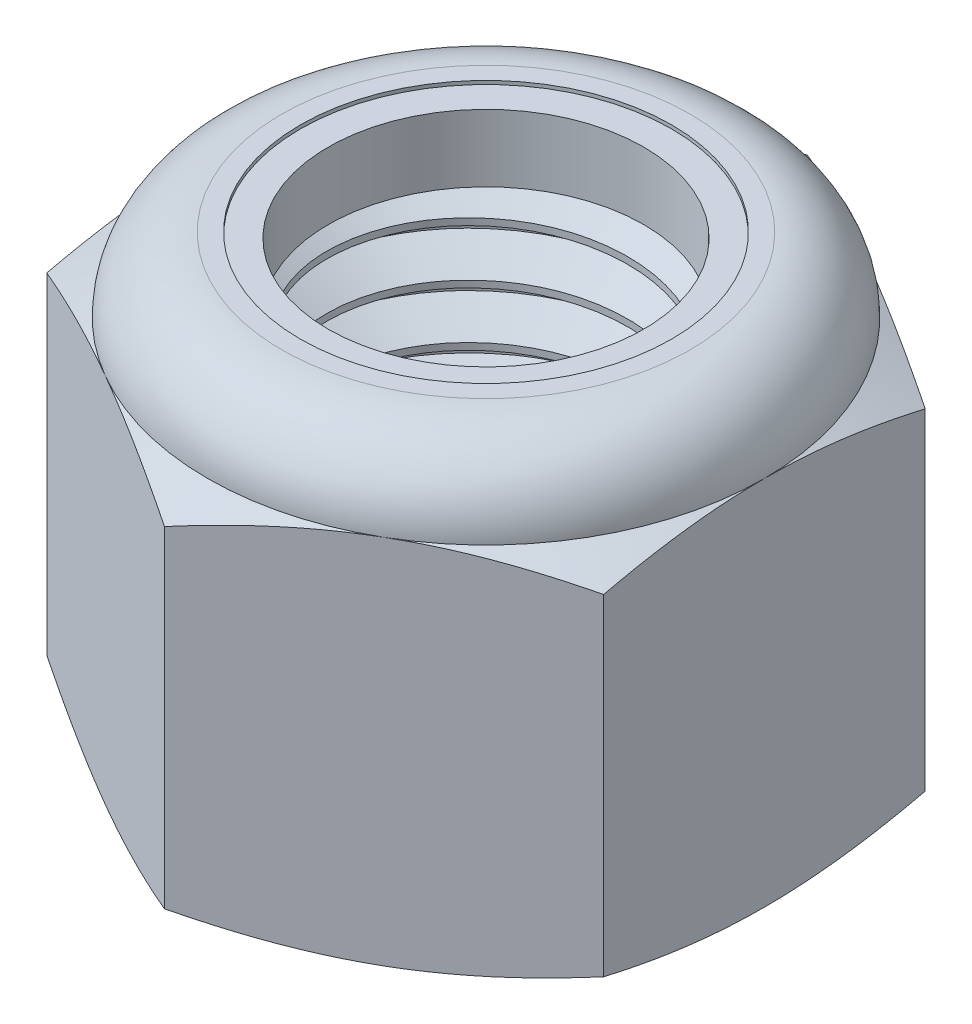
from build123d import *

# Parameters (mm, degrees)
SKETCH13_R       = 7.9375
EXTRUDE1_DEPTH   = 19.05
SKETCH2_W        = 7.9375
SKETCH2_H        = 15.875
CUT_SWEEP1_PITCH = 2.309090909
SKETCH12_W       = 8.73125
SKETCH12_H       = 15.875


with BuildPart() as part:
    # Sketch13 → Extrude1 (new body)
    with BuildSketch(Plane(origin=(0, 0, 0), x_dir=(1, 0, 0), z_dir=(0, 1, 0))):
        Polygon((0, 13.748153285), (-11.90625, 6.874076643), (-11.90625, -6.874076643), (0, -13.748153285), (11.90625, -6.874076643), (11.90625, 6.874076643), align=None)
        with Locations(Location((0, 0, 0), (0, 0, 270))):
            Circle(SKETCH13_R, mode=Mode.SUBTRACT)
    extrude(amount=EXTRUDE1_DEPTH)

    # Sketch5 → Cut-Revolve3 (revolve, cut)
    with BuildSketch(Plane(origin=(0, 0, 0), x_dir=(0, 0, -1), z_dir=(1, 0, 0))):
        with BuildLine():
            Line((0, 0), (11.90625, 0))
            Line((11.90625, 0), (13.748153285, 0.858893607))
            Line((13.748153285, 0.858893607), (13.748153285, 15.016106393))
            Line((13.748153285, 15.016106393), (11.90625, 15.875))
            ThreePointArc((11.90625, 15.875), (10.97631403, 18.12006403), (8.73125, 19.05))
            Line((8.73125, 19.05), (8.73125, 20.32))
            Line((8.73125, 20.32), (15.018153285, 20.32))
            Line((15.018153285, 20.32), (15.018153285, -1.27))
            Line((15.018153285, -1.27), (0, -1.27))
            Line((0, -1.27), (0, 0))
        make_face()
    revolve(axis=Axis((0, 0, 0), (0, 1, 0)), mode=Mode.SUBTRACT)

    # Sketch6 → Cut-Revolve4 (revolve, cut)
    with BuildSketch(Plane(origin=(0, 0, 0), x_dir=(0, 0, -1), z_dir=(1, 0, 0)), mode=Mode.PRIVATE) as cut_revolve4_sk:
        with BuildLine():
            Line((0, 15.875), (11.75385, 15.875))
            ThreePointArc((11.75385, 15.875), (10.868550957, 18.012300957), (8.73125, 18.8976))
            Line((8.73125, 18.8976), (4.365625, 18.8976))
            Line((4.365625, 18.8976), (4.365625, 20.32))
            Line((4.365625, 20.32), (0, 20.32))
            Line((0, 20.32), (0, 15.875))
        make_face()
    revolve(cut_revolve4_sk.sketch.rotate(Axis((0, 20.32, 0), (0, -1, 0)), 180), axis=Axis((0, 20.32, 0), (0, -1, 0)), mode=Mode.SUBTRACT)

    # Sketch4 → Cut-Revolve2 (revolve, cut)
    with BuildSketch(Plane(origin=(0, 0, 0), x_dir=(0, 0, -1), z_dir=(1, 0, 0))):
        Polygon((0, 15.875), (8.73125, 15.875), (0, 11.80355126), align=None)
        Polygon((0, 4.07144874), (8.73125, 0), (0, 0), align=None)
    revolve(axis=Axis((0, 0, 0), (0, 1, 0)), mode=Mode.SUBTRACT)

    # Sketch12 → Revolve4 (revolve)
    with BuildSketch(Plane(origin=(0, 0, 0), x_dir=(0, 0, -1), z_dir=(1, 0, 0)), mode=Mode.PRIVATE) as revolve4_sk:
        with Locations((4.365625, 7.9375)):
            Rectangle(SKETCH12_W, SKETCH12_H)
    revolve(revolve4_sk.sketch.rotate(Axis((0, 0, 0), (0, 1, 0)), 31.644514514), axis=Axis((0, 0, 0), (0, 1, 0)))


with BuildPart() as body_2:
    # Sketch7 → Revolve2 (revolve)
    with BuildSketch(Plane(origin=(0, 0, 0), x_dir=(0, 0, -1), z_dir=(1, 0, 0))):
        with BuildLine():
            Line((6.746875, 15.9512), (11.67666449, 15.9512))
            ThreePointArc((11.67666449, 15.9512), (10.787552176, 17.985188219), (8.73125, 18.8214))
            Line((8.73125, 18.8214), (6.746875, 18.8214))
            Line((6.746875, 18.8214), (6.746875, 15.9512))
        make_face()
    revolve(axis=Axis((0, 15.9512, 0), (0, 1, 0)))


with BuildPart() as body_3:
    # Sketch2 → Revolve1 (revolve)
    with BuildSketch(Plane(origin=(0, 0, 0), x_dir=(0, 0, -1), z_dir=(1, 0, 0))):
        with Locations((3.96875, 7.9375)):
            Rectangle(SKETCH2_W, SKETCH2_H)
    revolve(axis=Axis((0, -7.9375, 0), (0, 1, 0)))

    # Cut-Sweep1: the profile of Sketch9 screwed along a right-hand helix of 9.25 turns, 10 arcs to a turn; built about Z, then put on its axis
    cut_sweep1_z = Axis((0, 0, 0), (0, 0, 1))
    cut_sweep1_corners = [(8.187466423, 0, 0.144318182), (8.062483212, 0, -2.092613636), (6.43770146, 0, -1.154545455), (6.43770146, 0, -0.865909091)]
    with BuildLine(mode=Mode.PRIVATE) as cut_sweep1_profile:
        Line(cut_sweep1_corners[0], cut_sweep1_corners[1])
        Line(cut_sweep1_corners[1], cut_sweep1_corners[2])
        Line(cut_sweep1_corners[2], cut_sweep1_corners[3])
        Line(cut_sweep1_corners[3], cut_sweep1_corners[0])
    cut_sweep1_cap = Face(cut_sweep1_profile.wire())
    cut_sweep1_turn_angles = [0, 18, 36, 54, 72, 90, 108, 126, 144, 162, 180, 198, 216, 234, 252, 270, 288, 306, 324, 342, 360]
    cut_sweep1_turn_weights = [1, 0.9510565162951535, 1, 0.9510565162951535, 1, 0.9510565162951535, 1, 0.9510565162951535, 1, 0.9510565162951535, 1, 0.9510565162951535, 1, 0.9510565162951535, 1, 0.9510565162951535, 1, 0.9510565162951535, 1, 0.9510565162951535, 1]
    cut_sweep1_turn_rails = [Edge.make_bspline([Vector(p[0], p[1], 0).rotate(cut_sweep1_z, cut_sweep1_turn_angles[k]) / cut_sweep1_turn_weights[k] + Vector(0, 0, p[2] + CUT_SWEEP1_PITCH * cut_sweep1_turn_angles[k] / 360) for k in range(21)], [0, 0, 0, 1, 1, 2, 2, 3, 3, 4, 4, 5, 5, 6, 6, 7, 7, 8, 8, 9, 9, 10, 10, 10], 2, cut_sweep1_turn_weights) for p in cut_sweep1_corners]
    cut_sweep1_turn_sides = [Face.make_surface_from_curves(cut_sweep1_turn_rails[p[0]], cut_sweep1_turn_rails[p[1]]) for p in [(0, 1), (1, 2), (2, 3), (3, 0)]]
    cut_sweep1_last_angles = [3240, 3258, 3276, 3294, 3312, 3321, 3330]
    cut_sweep1_last_weights = [1, 0.9510565162951535, 1, 0.9510565162951535, 1, 0.987688340595139, 1]
    cut_sweep1_last_rails = [Edge.make_bspline([Vector(p[0], p[1], 0).rotate(cut_sweep1_z, cut_sweep1_last_angles[k]) / cut_sweep1_last_weights[k] + Vector(0, 0, p[2] + CUT_SWEEP1_PITCH * cut_sweep1_last_angles[k] / 360) for k in range(7)], [0, 0, 0, 1, 1, 2, 2, 3, 3, 3], 2, cut_sweep1_last_weights) for p in cut_sweep1_corners]
    cut_sweep1_last_sides = [Face.make_surface_from_curves(cut_sweep1_last_rails[p[0]], cut_sweep1_last_rails[p[1]]) for p in [(0, 1), (1, 2), (2, 3), (3, 0)]]
    cut_sweep1 = Plane(origin=(0, 15.875, 0), x_dir=(0, 0, -1), z_dir=(0, -1, 0)) * Solid(Shell([*[p.moved(Location((0, 0, CUT_SWEEP1_PITCH * i))) for i in range(9) for p in cut_sweep1_turn_sides], *cut_sweep1_last_sides, cut_sweep1_cap, cut_sweep1_cap.rotate(cut_sweep1_z, 3330).moved(Location((0, 0, CUT_SWEEP1_PITCH * 3330 / 360)))]))
    add(cut_sweep1, mode=Mode.SUBTRACT)

    # Sketch11 → Revolve3 (revolve)
    with BuildSketch(Plane(origin=(0, 0, 0), x_dir=(0, 0, -1), z_dir=(1, 0, 0))):
        Polygon((0, 0), (8.73125, 0), (0, 4.07144874), align=None)
    revolve(axis=Axis((0, 19.05, 0), (0, -1, 0)))


with BuildPart() as part_1:
    add(part.part)

    # Combine1: cut body 3
    add(body_3.part, mode=Mode.SUBTRACT)


solid = Compound([body_2.part, part_1.part])
